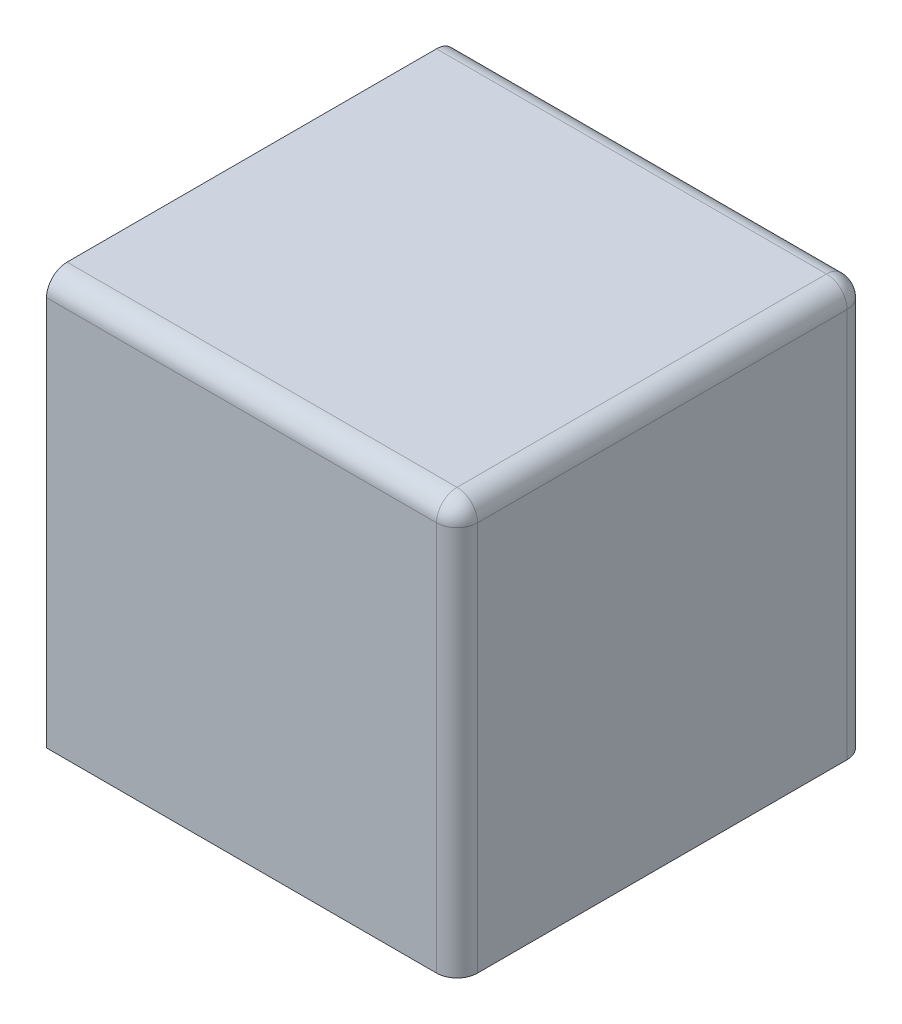
from build123d import *

# Parameters (mm, degrees)
SKETCH1_W           = 20
SKETCH1_H           = 20
BOSS_EXTRUDE1_DEPTH = 20
SKETCH2_R           = 2.05
BOSS_EXTRUDE2_DEPTH = 5
FILLET1_R           = 1


with BuildPart() as part:
    # Sketch1 → Boss-Extrude1 (new body)
    with BuildSketch(Plane(origin=(0, 0, 0), x_dir=(1, 0, 0), z_dir=(0, 1, 0))):
        Rectangle(SKETCH1_W, SKETCH1_H)
    extrude(amount=BOSS_EXTRUDE1_DEPTH)

    # Sketch2 → Boss-Extrude2 (add)
    with BuildSketch(Plane.ZY.offset(10)):
        with Locations((0, 10)):
            Circle(SKETCH2_R)
    extrude(amount=BOSS_EXTRUDE2_DEPTH)

    # Fillet1
    fillet1_edges = [part.edges().sort_by_distance(p)[0] for p in [
        (10, 10, 10),
        (10, 10, -10),
        (0, 20, 10),
        (10, 20, 0),
        (0, 20, -10),
    ]]
    fillet(fillet1_edges, radius=FILLET1_R)


solid = part.part
